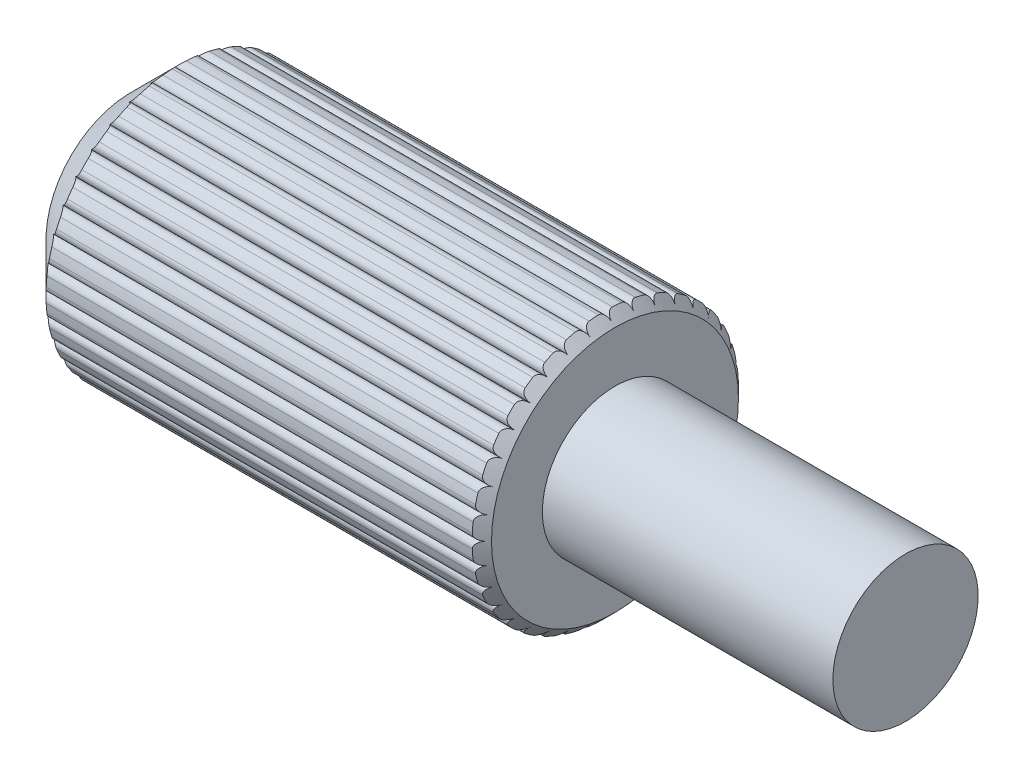
from build123d import *

# Parameters (mm, degrees)
CHAMFER_1_SIZE           = 1
CHAMFER_2_SIZE           = 0.2
CUT_EXTRUDE_2_REACH      = 18.466
PATTERN_CIRCULAR_2_COUNT = 36


with BuildPart() as part:
    # 草图2 → 旋转1 (revolve)
    with BuildSketch(Plane.XY, mode=Mode.PRIVATE) as revolve_1_sk:
        Polygon((0, 0), (0, 2.75), (10, 2.75), (10, 1.5), (16, 1.5), (16, 0), align=None)
    revolve(revolve_1_sk.sketch.rotate(Axis((-1.147741203, 0, 0), (1, 0, 0)), 90), axis=Axis((-1.147741203, 0, 0), (1, 0, 0)))

    # 倒角1
    chamfer_1_edges = [part.edges().sort_by_distance(p)[0] for p in [
        (0, 0, -2.75),
    ]]
    chamfer(chamfer_1_edges, length=CHAMFER_1_SIZE)

    # 倒角2
    chamfer_2_edges = [part.edges().sort_by_distance(p)[0] for p in [
        (10, 0, -2.75),
    ]]
    chamfer(chamfer_2_edges, length=CHAMFER_2_SIZE)

    # 草图3 → 切除-拉伸2 (cut, up to next)
    with BuildSketch(Plane.ZY, mode=Mode.PRIVATE) as cut_extrude_2_sk1:
        with BuildLine():
            ThreePointArc((0.144736842, 2.746188494), (0, 2.75), (-0.144736842, 2.746188494))
            ThreePointArc((-0.144736842, 2.746188494), (-0.04286601, 2.708632054), (0, 2.60887907))
            ThreePointArc((0, 2.60887907), (0.04286601, 2.708632054), (0.144736842, 2.746188494))
        make_face()
    cut_extrude_2_tool1 = extrude(cut_extrude_2_sk1.sketch, amount=-CUT_EXTRUDE_2_REACH, mode=Mode.PRIVATE) & part.part
    cut_extrude_2 = cut_extrude_2_tool1.solids().sort_by_distance((0, 2.718157, 0))[0]
    add(cut_extrude_2, mode=Mode.SUBTRACT)

    # 阵列(圆周)2: 切除-拉伸2 ×36 about axis
    pattern_circular_2_axis = Axis((0, 0, 0), (1, 0, 0))
    for i in range(1, PATTERN_CIRCULAR_2_COUNT):
        add(cut_extrude_2.rotate(pattern_circular_2_axis, i * 360 / PATTERN_CIRCULAR_2_COUNT), mode=Mode.SUBTRACT)


solid = part.part
